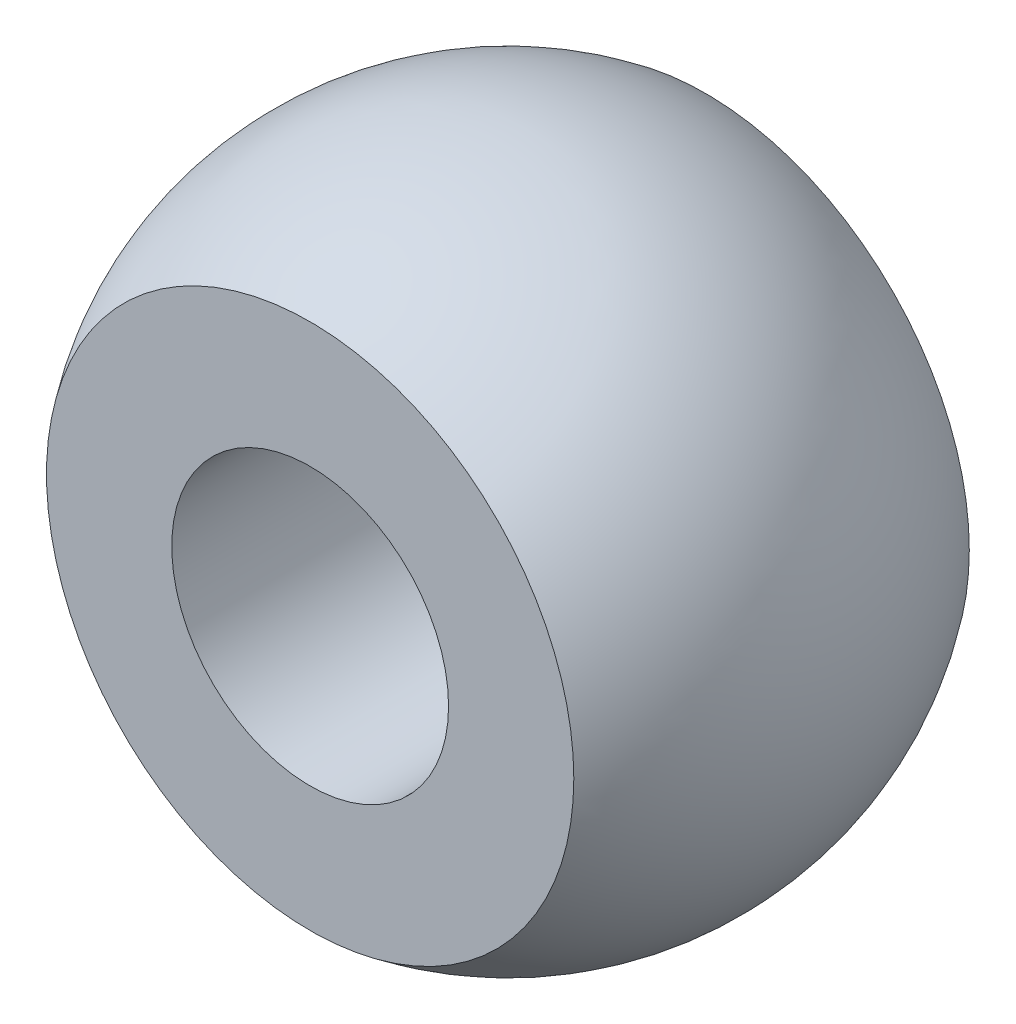
from build123d import *

# Parameters (mm, degrees)
FLAT_HEIGHT_ENVELOPE_START = -1.5
SKETCH1_R                  = 2.51
FLAT_HEIGHT_ENVELOPE_DEPTH = 3
SKETCH2_R                  = 1.05
D2P1_MOUNTING_BORE_DEPTH   = 3.01


# Read off the part's stored shape, not the designer's step: Truncated_True_Sphere
with BuildPart() as part:
    # Sketch1 → Flat_Height_Envelope (new body)
    with BuildSketch(Plane.XY.offset(FLAT_HEIGHT_ENVELOPE_START)):
        Circle(SKETCH1_R)
    extrude(amount=FLAT_HEIGHT_ENVELOPE_DEPTH)

    # Truncated_True_Sphere outline → Truncated_True_Sphere (revolve, cut)
    with BuildSketch(Plane.XZ):
        with BuildLine():
            ThreePointArc((1.999999998, 1.500000002), (2.5, 0), (1.999999998, -1.500000002))
            Line((1.999999998, -1.500000002), (2.51, -1.500000002))
            Line((2.51, -1.500000002), (2.51, 1.5))
            Line((2.51, 1.5), (1.999999998, 1.500000002))
        make_face()
    revolve(axis=Axis((0, 0, 0), (0, 0, 1)), mode=Mode.SUBTRACT)

    # Sketch2 → D2p1_Mounting_Bore (cut)
    with BuildSketch(Plane.XY.offset(1.5)):
        Circle(SKETCH2_R)
    extrude(amount=-D2P1_MOUNTING_BORE_DEPTH, mode=Mode.SUBTRACT)


solid = part.part
